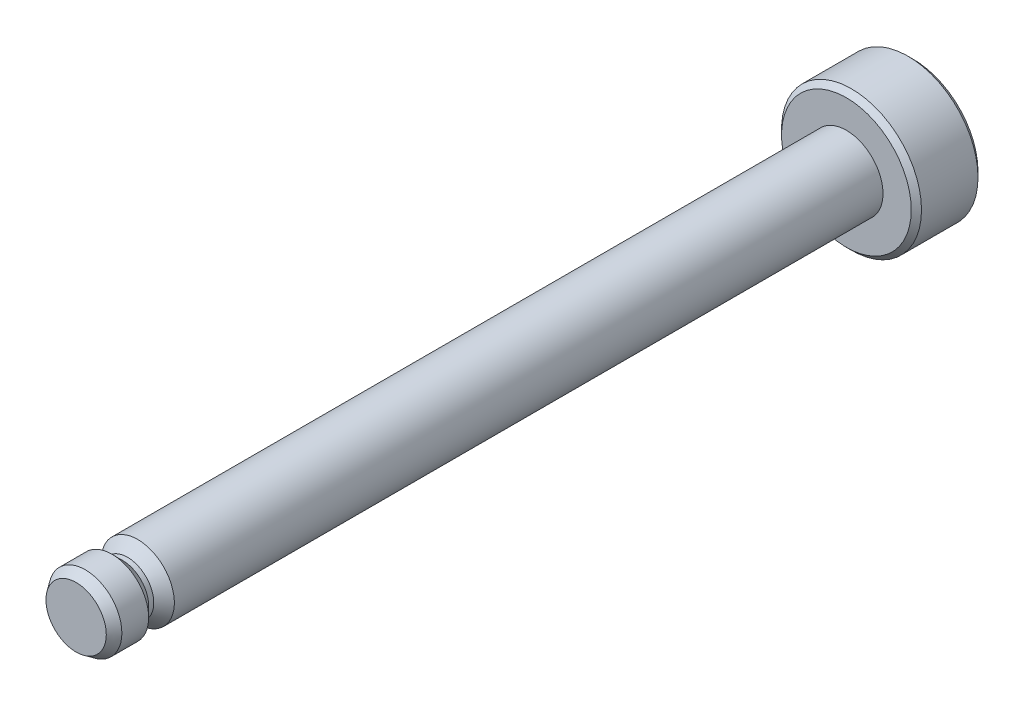
from build123d import *

# Parameters (mm, degrees)
SKETCH2_R      = 1.425
SHAFT_DEPTH    = 30
SKETCH5_R      = 2.725
HEAD_DEPTH     = 2.6
CHAMFER1_SIZE  = 0.25
CHAMFER1_SIZE2 = 0.357037002
DEBURS_SIZE    = 0.2


with BuildPart() as part:
    # Sketch2 → Shaft (new body)
    with BuildSketch(Plane.XY):
        Circle(SKETCH2_R)
    extrude(amount=SHAFT_DEPTH)

    # Sketch5 → Head (add)
    with BuildSketch(Plane.XY):
        Circle(SKETCH5_R)
    extrude(amount=-HEAD_DEPTH)

    # Chamfer1
    chamfer1_edges = [part.edges().sort_by_distance(p)[0] for p in [
        (-1.425, 0, 30),
    ]]
    chamfer1_side = [part.faces().sort_by_distance(p)[0] for p in [
        (0, 0, 30),
    ]]
    chamfer(chamfer1_edges, length=CHAMFER1_SIZE, length2=CHAMFER1_SIZE2, reference=chamfer1_side[0])

    # Deburs
    deburs_edges = [part.edges().sort_by_distance(p)[0] for p in [
        (-2.725, 0, 0),
        (-2.725, 0, -2.6),
    ]]
    chamfer(deburs_edges, length=DEBURS_SIZE)

    # Sketch6 → e-Clip Notch Long (revolve, cut)
    with BuildSketch(Plane(origin=(0, 0, 0), x_dir=(0, 0, -1), z_dir=(1, 0, 0))):
        Polygon((-28.6, 1.425), (-27.6, 1.425), (-28, 1.025), (-28.2, 1.025), align=None)
    revolve(axis=Axis((0, 0, 0), (0, 0, 1)), mode=Mode.SUBTRACT)


solid = part.part
